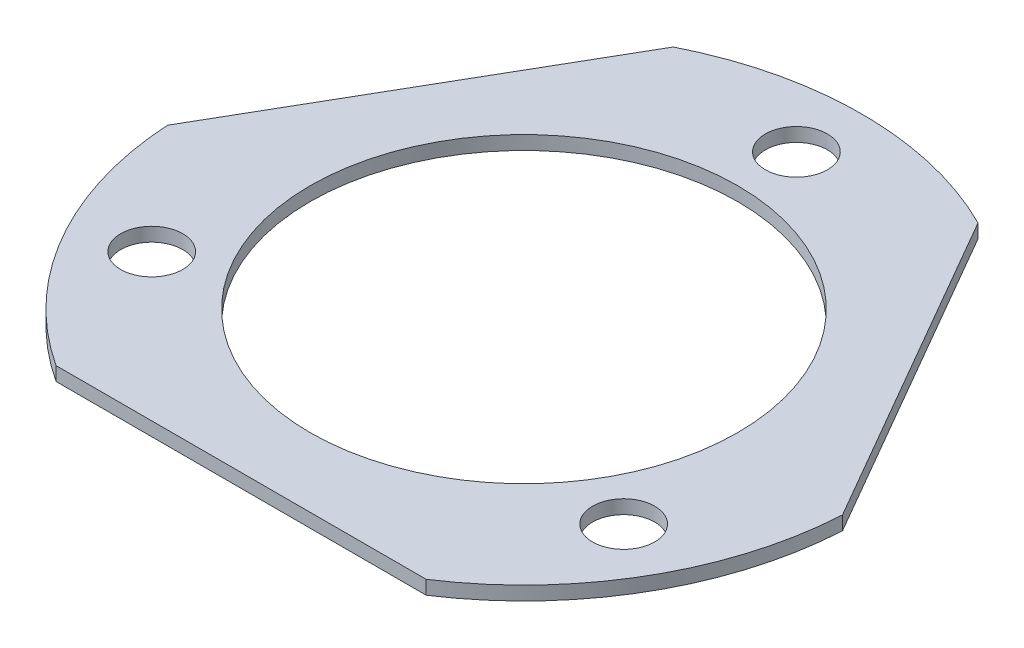
from build123d import *

# Parameters (mm, degrees)
ESBO_O1_R          = 31
ESBO_O1_R_2        = 4.5
FLANGE_BASE1_DEPTH = 2


# Sheet-metal steps are written as plain solids
with BuildPart() as part:
    # Esboço1 → Flange-base1 (new body)
    with BuildSketch(Plane(origin=(0, 0, 0), x_dir=(1, 0, 0), z_dir=(0, 1, 0))):
        with BuildLine():
            Line((-22.09063369, 43.737900077), (-48.92344942, -2.737900077))
            ThreePointArc((-48.92344942, -2.737900077), (-42.435244785, -24.5), (-26.83281573, -41))
            Line((-26.83281573, -41), (26.83281573, -41))
            ThreePointArc((26.83281573, -41), (42.435244785, -24.5), (48.92344942, -2.737900077))
            Line((48.92344942, -2.737900077), (22.09063369, 43.737900077))
            ThreePointArc((22.09063369, 43.737900077), (0, 49), (-22.09063369, 43.737900077))
        make_face()
        with Locations(Location((0, 0, 0), (0, 0, 270))):
            Circle(ESBO_O1_R, mode=Mode.SUBTRACT)
        with Locations(Location((0, 39.5, 0), (0, 0, 270))):
            Circle(ESBO_O1_R_2, mode=Mode.SUBTRACT)
        with Locations(Location((34.208003449, -19.75, 0), (0, 0, 270))):
            Circle(ESBO_O1_R_2, mode=Mode.SUBTRACT)
        with Locations(Location((-34.208003449, -19.75, 0), (0, 0, 270))):
            Circle(ESBO_O1_R_2, mode=Mode.SUBTRACT)
    extrude(amount=-FLANGE_BASE1_DEPTH)


solid = part.part
